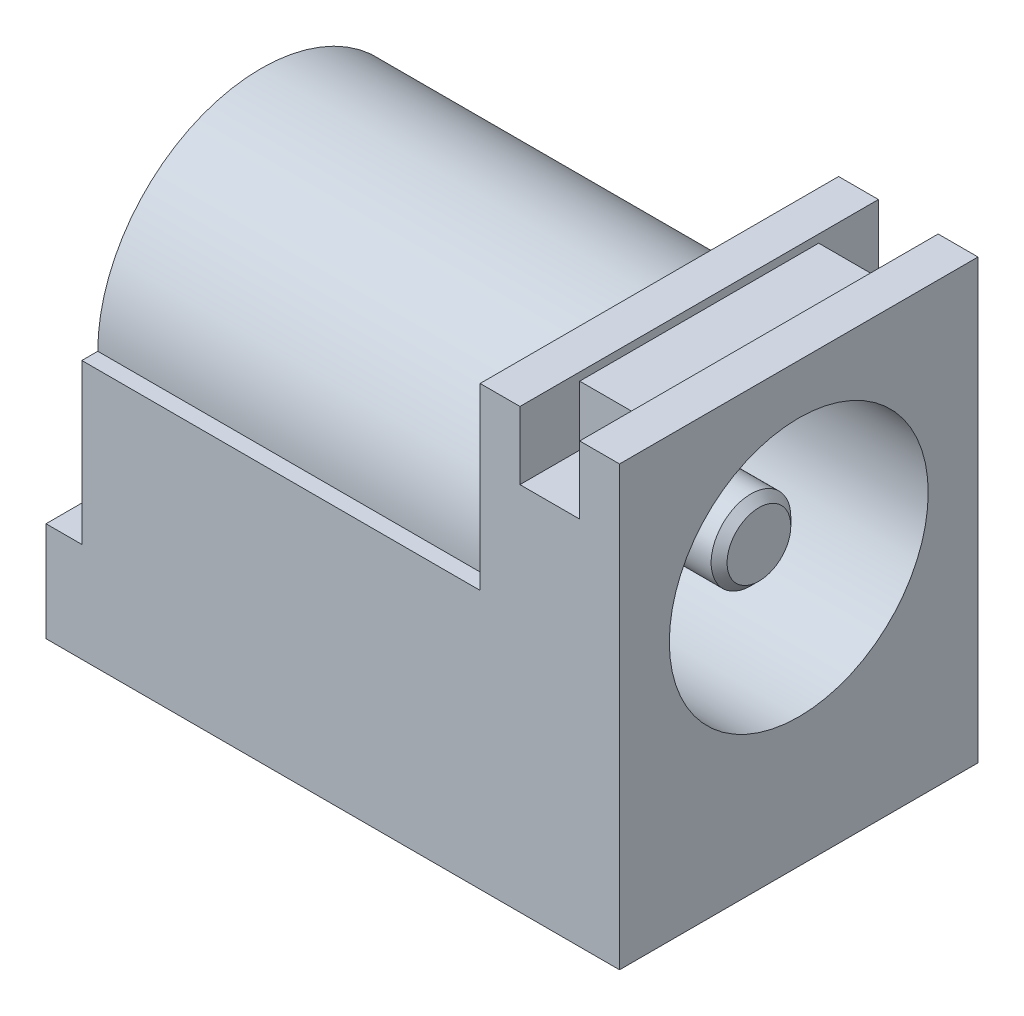
from build123d import *

# Parameters (mm, degrees)
BOSS_EXTRUDE1_START            = -9
BOSS_EXTRUDE1_DEPTH            = 9
BOSS_EXTRUDE1_2_DEPTH          = 0.4
BOSS_EXTRUDE1_START_2          = -11.95
BOSS_EXTRUDE1_3_DEPTH          = 2.5
SKETCH2_W                      = 9
SKETCH2_H                      = 11
BOSS_EXTRUDE2_DEPTH            = 2.45
SKETCH3_W                      = 0.9
SKETCH3_H                      = 8.5
CUT_EXTRUDE1_DEPTH             = 20.892712233
SKETCH4_W                      = 0.52
SKETCH4_H                      = 6
CUT_EXTRUDE2_DEPTH             = 19.771520983
BOSS_EXTRUDE3_DEPTH            = 0.36
SKETCH6_W                      = 5.62
SKETCH6_H                      = 3
BOSS_EXTRUDE4_DEPTH            = 0.36
SKETCH7_W                      = 3
SKETCH7_H                      = 2.5
BOSS_EXTRUDE5_DEPTH            = 0.52
SKETCH8_W                      = 1.5
SKETCH8_H                      = 1.7
CUT_EXTRUDE3_DEPTH             = 20.7068516
SKETCH9_W                      = 6
SKETCH9_H                      = 1.5
BOSS_EXTRUDE6_DEPTH            = 1.5
SKETCH10_W                     = 10
SKETCH10_H                     = 4.5
CUT_EXTRUDE4_DEPTH             = 20.7068516
BOSS_EXTRUDE7_DEPTH            = 10
BOSS_EXTRUDE8_DEPTH            = 0.25
F_6_5_6_5_DIAMETER_HOLE1_D     = 6.5
F_6_5_6_5_DIAMETER_HOLE1_DEPTH = 7
SKETCH15_W                     = 6
SKETCH15_H                     = 1
SKETCH16_W                     = 0.75
SKETCH16_H                     = 7.825
F_1_5_1_5_DIAMETER_HOLE2_D     = 1.5
F_1_5_1_5_DIAMETER_HOLE3_D     = 1.5
F_1_5_1_5_DIAMETER_HOLE3_DEPTH = 13.88
CHAMFER1_SIZE                  = 0.2


with BuildPart() as part:
    # Boss-Extrude1: read off the stored shape, not the designer's step
    # Boss-Extrude1 outline → Boss-Extrude1 (new body)
    with BuildSketch(Plane(origin=(0, 0, -4.5), x_dir=(-1, 0, 0), z_dir=(0, 0, -1)).offset(BOSS_EXTRUDE1_START)):
        Polygon((11.95, -6.5), (11.95, 4.5), (0, 4.5), (0, -6.5), (9.45, -6.5), align=None)
    extrude(amount=BOSS_EXTRUDE1_DEPTH)

    # Boss-Extrude1 2 outline → Boss-Extrude1 2 (add)
    with BuildSketch(Plane(origin=(0, 0, -4.5), x_dir=(-1, 0, 0), z_dir=(0, 0, -1))):
        with BuildLine():
            Line((11.95, -8.75), (11.95, -6.5))
            Line((11.95, -6.5), (9.45, -6.5))
            Line((9.45, -6.5), (9.45, -8.75))
            ThreePointArc((9.45, -8.75), (10.7, -10), (11.95, -8.75))
        make_face()
    extrude(amount=BOSS_EXTRUDE1_2_DEPTH)

    # Boss-Extrude1 3 outline → Boss-Extrude1 3 (add)
    with BuildSketch(Plane.YZ.offset(BOSS_EXTRUDE1_START_2)):
        with BuildLine():
            Line((-6.5, -4.9), (-3.989897949, -4.9))
            ThreePointArc((-3.989897949, -4.9), (-3.673670183, -4.787298335), (-3.5, -4.5))
            Line((-3.5, -4.5), (-6.5, -4.5))
            Line((-6.5, -4.5), (-6.5, -4.9))
        make_face()
    extrude(amount=BOSS_EXTRUDE1_3_DEPTH)

    # Sketch2 → Boss-Extrude2 (add)
    with BuildSketch(Plane.ZY.offset(11.95)):
        with Locations((0, -1)):
            Rectangle(SKETCH2_W, SKETCH2_H)
    extrude(amount=BOSS_EXTRUDE2_DEPTH)

    # Sketch3 → Cut-Extrude1 (cut, through all)
    with BuildSketch(Plane.XY.offset(4.5)):
        with Locations((-13.95, 0.25)):
            Rectangle(SKETCH3_W, SKETCH3_H)
    extrude(amount=-CUT_EXTRUDE1_DEPTH, mode=Mode.SUBTRACT)

    # Sketch4 → Cut-Extrude2 (cut, through all)
    with BuildSketch(Plane.XZ.offset(6.5)):
        with Locations((-14.14, -1.5)):
            Rectangle(SKETCH4_W, SKETCH4_H)
    extrude(amount=-CUT_EXTRUDE2_DEPTH, mode=Mode.SUBTRACT)

    # Sketch5 → Boss-Extrude3 (add)
    with BuildSketch(Plane(origin=(-13.88, 0, 0), x_dir=(0, -1, 0), z_dir=(-1, 0, 0))):
        with BuildLine():
            Line((6.5, -1.5), (8.5, -1.5))
            ThreePointArc((8.5, -1.5), (10, 0), (8.5, 1.5))
            Line((8.5, 1.5), (6.5, 1.5))
            Line((6.5, 1.5), (6.5, -1.5))
        make_face()
    extrude(amount=-BOSS_EXTRUDE3_DEPTH)

    # Sketch6 → Boss-Extrude4 (add)
    with BuildSketch(Plane(origin=(-13.88, 0, 0), x_dir=(0, -1, 0), z_dir=(-1, 0, 0))):
        with Locations((1.19, 0)):
            Rectangle(SKETCH6_W, SKETCH6_H)
    extrude(amount=-BOSS_EXTRUDE4_DEPTH)

    # Sketch7 → Boss-Extrude5 (add)
    with BuildSketch(Plane.ZY.offset(13.88)):
        with Locations((-3, -5.25)):
            Rectangle(SKETCH7_W, SKETCH7_H)
    extrude(amount=BOSS_EXTRUDE5_DEPTH)

    # Sketch8 → Cut-Extrude3 (cut, through all)
    with BuildSketch(Plane(origin=(0, 0, -4.5), x_dir=(-1, 0, 0), z_dir=(0, 0, -1))):
        with Locations((1.75, 3.65)):
            Rectangle(SKETCH8_W, SKETCH8_H)
    extrude(amount=-CUT_EXTRUDE3_DEPTH, mode=Mode.SUBTRACT)

    # Sketch9 → Boss-Extrude6 (add)
    with BuildSketch(Plane(origin=(-2.5, 0, 0), x_dir=(0, 0, -1), z_dir=(1, 0, 0))):
        with Locations((0, 3.55)):
            Rectangle(SKETCH9_W, SKETCH9_H)
    extrude(amount=BOSS_EXTRUDE6_DEPTH)

    # Sketch10 → Cut-Extrude4 (cut, through all)
    with BuildSketch(Plane(origin=(0, 0, -4.5), x_dir=(-1, 0, 0), z_dir=(0, 0, -1))):
        with Locations((8.5, 2.25)):
            Rectangle(SKETCH10_W, SKETCH10_H)
    extrude(amount=-CUT_EXTRUDE4_DEPTH, mode=Mode.SUBTRACT)

    # Sketch11 → Boss-Extrude7 (add)
    with BuildSketch(Plane.ZY.offset(3.5)):
        with BuildLine():
            Line((4.1, 0), (-4.1, 0))
            ThreePointArc((-4.1, 0), (0, 4.1), (4.1, 0))
        make_face()
    extrude(amount=BOSS_EXTRUDE7_DEPTH)

    # Sketch12 → Boss-Extrude8 (add)
    with BuildSketch(Plane(origin=(-7.825, 0, 0), x_dir=(0, -1, 0), z_dir=(-1, 0, 0))):
        with BuildLine():
            Line((8.75, 1.25), (6.5, 1.25))
            Line((6.5, 1.25), (6.5, -1.25))
            Line((6.5, -1.25), (8.75, -1.25))
            ThreePointArc((8.75, -1.25), (10, 0), (8.75, 1.25))
        make_face()
    extrude(amount=-BOSS_EXTRUDE8_DEPTH)

    # Ø6.5 (6.5) Diameter Hole1
    with Locations(Plane(origin=(0, 0, 0), x_dir=(0, 0, -1), z_dir=(1, 0, 0))):
        with Locations((0, 0)):
            Hole(F_6_5_6_5_DIAMETER_HOLE1_D / 2, depth=F_6_5_6_5_DIAMETER_HOLE1_DEPTH)

    # Sketch15 → Revolve1 (revolve)
    with BuildSketch(Plane.XY, mode=Mode.PRIVATE) as revolve1_sk:
        with Locations((-4, 0.5)):
            Rectangle(SKETCH15_W, SKETCH15_H)
    revolve(revolve1_sk.sketch.rotate(Axis((-7, 0, 0), (1, 0, 0)), 270), axis=Axis((-7, 0, 0), (1, 0, 0)))

    # Sketch16 → Ø1.5 (1.5) Diameter Hole1 (revolve, cut)
    with BuildSketch(Plane(origin=(-7.825, -8.75, 0), x_dir=(0, 0, 1), z_dir=(0, 1, 0))):
        with Locations((0.375, 3.9125)):
            Rectangle(SKETCH16_W, SKETCH16_H)
    revolve(axis=Axis((-14.175, -8.75, 0), (1, 0, 0)), mode=Mode.SUBTRACT)

    # Ø1.5 (1.5) Diameter Hole2 (through all)
    with Locations(Plane.XY.offset(-4.5)):
        with Locations((-10.7, -8.75)):
            Hole(F_1_5_1_5_DIAMETER_HOLE2_D / 2)

    # Ø1.5 (1.5) Diameter Hole3
    with Locations(Plane.ZY.offset(13.88)):
        with Locations((0, -8.75)):
            Hole(F_1_5_1_5_DIAMETER_HOLE3_D / 2, depth=F_1_5_1_5_DIAMETER_HOLE3_DEPTH)

    # Chamfer1
    chamfer1_edges = [part.edges().sort_by_distance(p)[0] for p in [
        (-1, 0, 1),
    ]]
    chamfer(chamfer1_edges, length=CHAMFER1_SIZE)


solid = part.part
